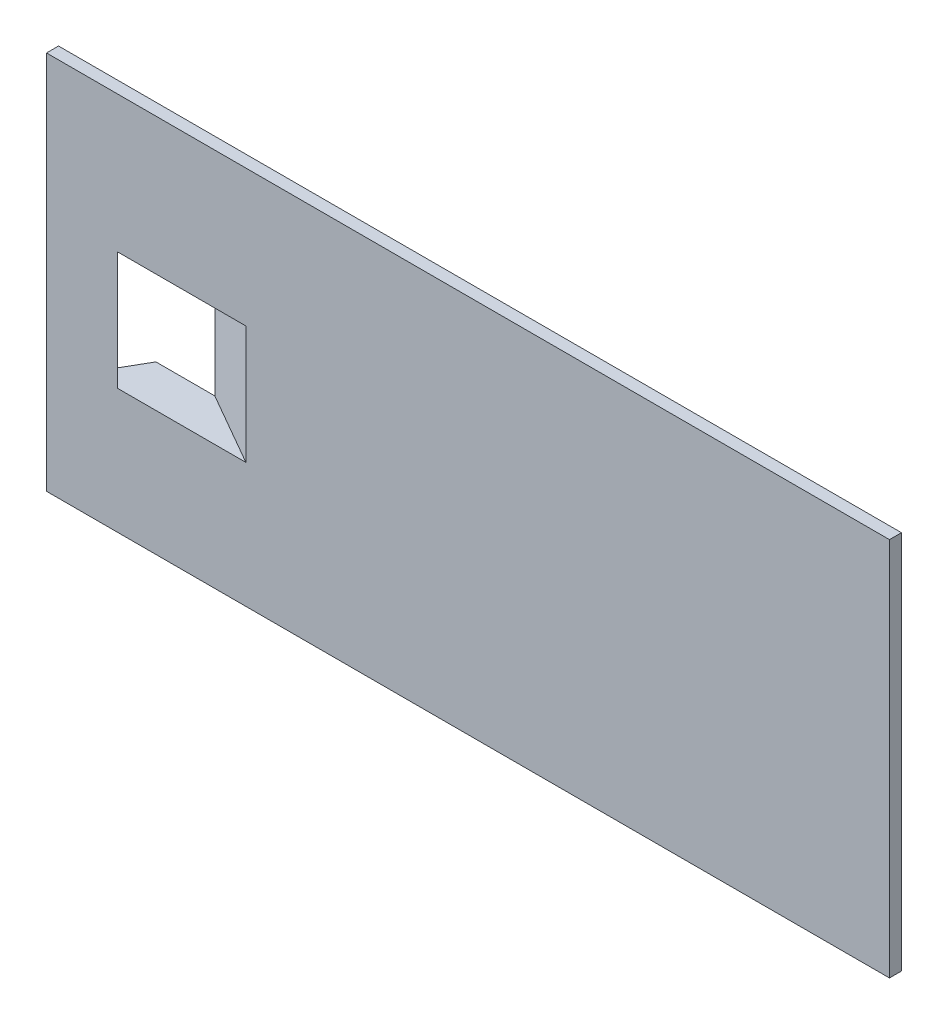
from build123d import *

# Parameters (mm, degrees)
SKETCH1_W           = 129.063503861
SKETCH1_H           = 57.862502499
BOSS_EXTRUDE1_DEPTH = 5
SKETCH2_W           = 36.260872389
SKETCH2_H           = 45.239555314
SKETCH2_W_2         = 34.782772322
SKETCH2_H_2         = 43.550253841
BOSS_EXTRUDE2_DEPTH = 1
SKETCH3_R           = 3.560103521
BOSS_EXTRUDE3_DEPTH = 1
CUT_EXTRUDE2_DEPTH  = 0.5
CUT_EXTRUDE3_DEPTH  = 0.5
SKETCH11_W          = 140.269028905
SKETCH11_H          = 63.169878757
BOSS_EXTRUDE4_DEPTH = 2
CUT_EXTRUDE11_DEPTH = 146.740563875
CUT_EXTRUDE12_DEPTH = 149.974025726
CUT_EXTRUDE15_DEPTH = 149.535595308
CUT_EXTRUDE18_DEPTH = 149.974025726
CUT_EXTRUDE20_DEPTH = 40


with BuildPart() as part:
    # Sketch1 → Boss-Extrude1 (new body)
    with BuildSketch(Plane.XY):
        with Locations((-61.962065286, -16.351878859)):
            Rectangle(SKETCH1_W, SKETCH1_H)
    extrude(amount=BOSS_EXTRUDE1_DEPTH)

    # Sketch2 → Boss-Extrude2 (add)
    with BuildSketch(Plane(origin=(0, 0, 0), x_dir=(-1, 0, 0), z_dir=(0, 0, -1))):
        with Locations((32.418116178, -15.92763049)):
            Rectangle(SKETCH2_W, SKETCH2_H)
        with Locations((32.418116178, -15.92763049)):
            Rectangle(SKETCH2_W_2, SKETCH2_H_2, mode=Mode.SUBTRACT)
    extrude(amount=BOSS_EXTRUDE2_DEPTH)

    # Sketch3 → Boss-Extrude3 (add)
    with BuildSketch(Plane(origin=(0, 0, 0), x_dir=(-1, 0, 0), z_dir=(0, 0, -1))):
        with Locations((5.84715491, -15.809376146)):
            Circle(SKETCH3_R)
    extrude(amount=BOSS_EXTRUDE3_DEPTH)

    # Sketch4 → Cut-Extrude2 (cut)
    with BuildSketch(Plane(origin=(0, 0, -1), x_dir=(-1, 0, 0), z_dir=(0, 0, -1))):
        with BuildLine():
            Line((7.498244586, -13.503730374), (7.429945817, -14.22683494))
            ThreePointArc((7.429945817, -14.22683494), (3.750240849, -15.79486572), (7.319195969, -17.600830429))
            Line((7.319195969, -17.600830429), (7.313770936, -18.341402976))
            ThreePointArc((7.313770936, -18.341402976), (3.134365244, -15.759677296), (7.498244586, -13.503730374))
        make_face()
    extrude(amount=-CUT_EXTRUDE2_DEPTH, mode=Mode.SUBTRACT)

    # Sketch5 → Cut-Extrude3 (cut)
    with BuildSketch(Plane(origin=(0, 0, -1), x_dir=(-1, 0, 0), z_dir=(0, 0, -1))):
        with BuildLine():
            Line((8.340052895, -15.49291333), (5.46397868, -15.438165983))
            ThreePointArc((5.46397868, -15.438165983), (5.066360432, -15.835784231), (5.46397868, -16.233402479))
            Line((5.46397868, -16.233402479), (8.340052895, -16.178655131))
            ThreePointArc((8.340052895, -16.178655131), (8.682923796, -15.835784231), (8.340052895, -15.49291333))
        make_face()
    extrude(amount=-CUT_EXTRUDE3_DEPTH, mode=Mode.SUBTRACT)

    # Sketch11 → Boss-Extrude4 (add)
    with BuildSketch(Plane.XY.offset(5)):
        with Locations((-64.601623086, -16.772300036)):
            Rectangle(SKETCH11_W, SKETCH11_H)
    extrude(amount=BOSS_EXTRUDE4_DEPTH)

    # Sketch12 → Cut-Extrude11 (cut, through all)
    with BuildSketch(Plane(origin=(2.569686645, 0, 0), x_dir=(0, 0, -1), z_dir=(1, 0, 0))):
        Polygon((-5.049502584, 12.555506791), (1.376837193, 8.637811028), (1.49491418, 17.884962826), align=None)
    extrude(amount=-CUT_EXTRUDE11_DEPTH, mode=Mode.SUBTRACT)

    # Sketch13 → Cut-Extrude12 (cut, through all)
    with BuildSketch(Plane(origin=(0, 14.812639343, 0), x_dir=(1, 0, 0), z_dir=(0, 1, 0))):
        Polygon((-126.405113906, -5), (-129.311029141, 1.46898876), (-122.374079844, 2.014276014), align=None)
    extrude(amount=-CUT_EXTRUDE12_DEPTH, mode=Mode.SUBTRACT)

    # Sketch14 → Cut-Extrude15 (cut, through all)
    with BuildSketch(Plane.ZY.offset(134.736137539)):
        Polygon((5, -45.234938719), (-1.330755584, -41.178219973), (-1.62330097, -49.506029315), align=None)
    extrude(amount=-CUT_EXTRUDE15_DEPTH, mode=Mode.SUBTRACT)

    # Sketch15 → Cut-Extrude18 (cut, through all)
    with BuildSketch(Plane(origin=(0, -48.357239414, 0), x_dir=(-1, 0, 0), z_dir=(0, -1, 0))):
        Polygon((-2.559600043, -5), (1.778800488, 1.23954643), (-4.071250311, 1.127548689), align=None)
    extrude(amount=-CUT_EXTRUDE18_DEPTH, mode=Mode.SUBTRACT)

    # Sketch17 → Cut-Extrude20 (cut)
    with BuildSketch(Plane(origin=(-92.862199247, 0, -53.366974362), x_dir=(-0.49826909719441087, 0, 0.8670224372996739), z_dir=(-0.8670224372996738, 0, -0.4982690971944108))):
        Polygon((67.318874173, -27.603763834), (67.318874173, -18.809544274), (67.318874173, -7.942798244), (56.669782452, -7.942798244), (56.669782452, -27.603763834), align=None)
    extrude(amount=-CUT_EXTRUDE20_DEPTH, mode=Mode.SUBTRACT)


solid = part.part
